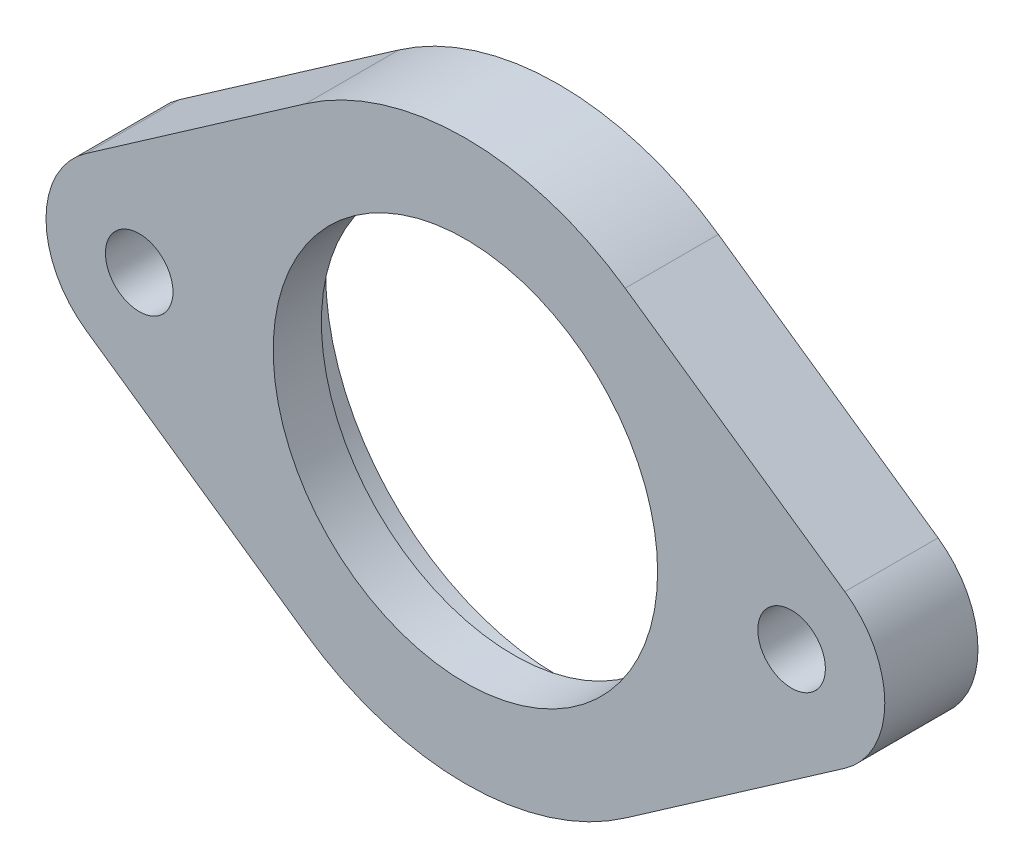
from build123d import *

# Parameters (mm, degrees)
BOSS_EXTRUDE1_DEPTH     = 4
CUT_EXTRUDE1_DEPTH      = 23
CUT_EXTRUDE1_DEPTH_BACK = 23
SKETCH1_4_R             = 8.25
CUT_EXTRUDE2_DEPTH      = 1.93
CUT_EXTRUDE2_DEPTH_BACK = 23
SKETCH1_6_R             = 10
M2_5_CLEARANCE_HOLE1_D  = 2.9


with BuildPart() as part:
    # Sketch1 → Boss-Extrude1 (new body)
    with BuildSketch(Plane.XY):
        with BuildLine():
            ThreePointArc((6.857142857, 9.84782168), (0, 12), (-6.857142857, 9.84782168))
            Line((-6.857142857, 9.84782168), (-16.285714286, 3.282607227))
            ThreePointArc((-16.285714286, 3.282607227), (-18, 0), (-16.285714286, -3.282607227))
            Line((-16.285714286, -3.282607227), (-6.857142857, -9.84782168))
            ThreePointArc((-6.857142857, -9.84782168), (0, -12), (6.857142857, -9.84782168))
            Line((6.857142857, -9.84782168), (16.285714286, -3.282607227))
            ThreePointArc((16.285714286, -3.282607227), (18, 0), (16.285714286, 3.282607227))
            Line((16.285714286, 3.282607227), (6.857142857, 9.84782168))
        make_face()
    extrude(amount=BOSS_EXTRUDE1_DEPTH)

    # Sketch1<4> → Cut-Extrude1 (cut, two sides: drawn at the far end of the back side and taken through both)
    with BuildSketch(Plane.XY.offset(-CUT_EXTRUDE1_DEPTH_BACK)):
        Circle(SKETCH1_4_R)
    extrude(amount=CUT_EXTRUDE1_DEPTH + CUT_EXTRUDE1_DEPTH_BACK, mode=Mode.SUBTRACT)

    # Sketch1<6> → Cut-Extrude2 (cut, two sides: drawn at the far end of the back side and taken through both)
    with BuildSketch(Plane.XY.offset(-CUT_EXTRUDE2_DEPTH_BACK)):
        Circle(SKETCH1_6_R)
    extrude(amount=CUT_EXTRUDE2_DEPTH + CUT_EXTRUDE2_DEPTH_BACK, mode=Mode.SUBTRACT)

    # M2.5 Clearance Hole1 (through all)
    with Locations(Plane.XY.offset(4)):
        with Locations((-14, 0), (14, 0)):
            Hole(M2_5_CLEARANCE_HOLE1_D / 2)


solid = part.part
